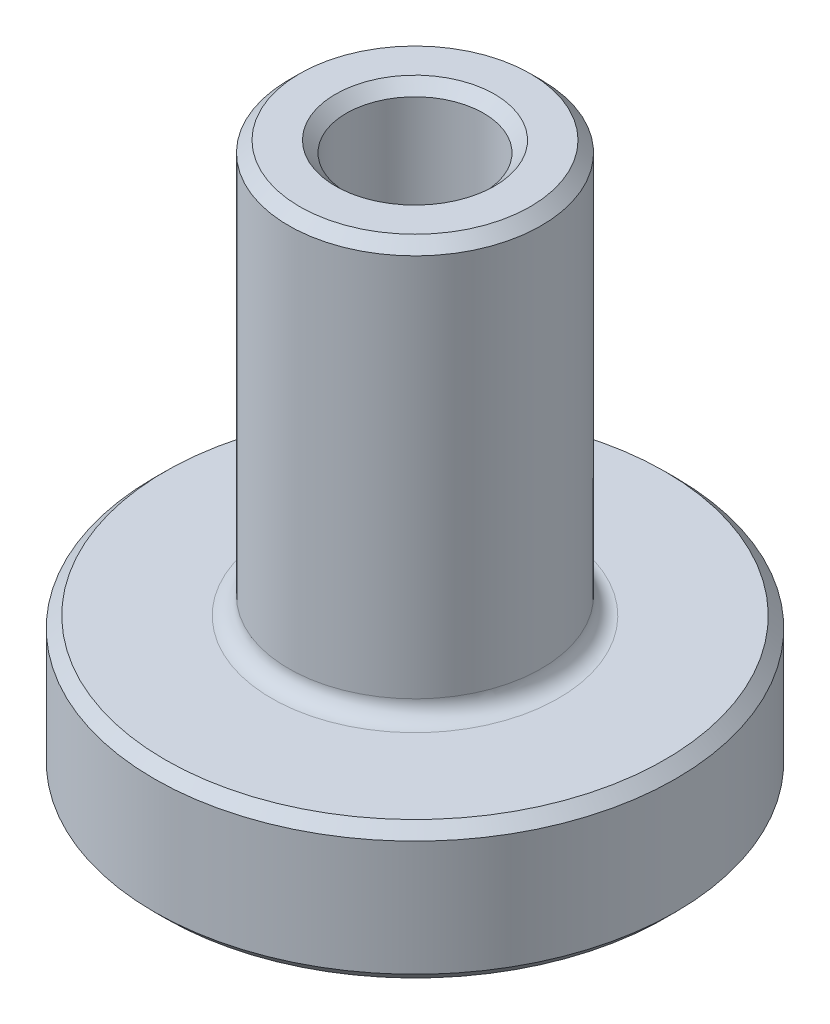
from build123d import *

# Parameters (mm, degrees)
FILLET1_R     = 0.396875
CHAMFER1_SIZE = 0.254


with BuildPart() as part:
    # Sketch1 → Revolve1 (revolve)
    with BuildSketch(Plane.XY):
        Polygon((1.5875, 0), (6.0325, 0), (6.0325, 3.175), (2.921, 3.175), (2.921, 12.7), (1.5875, 12.7), align=None)
    revolve(axis=Axis((0, 7.886499903, 0), (0, -1, 0)))

    # Fillet1
    fillet1_edges = [part.edges().sort_by_distance(p)[0] for p in [
        (-2.921, 3.175, 0),
    ]]
    fillet(fillet1_edges, radius=FILLET1_R)

    # Chamfer1
    chamfer1_edges = [part.edges().sort_by_distance(p)[0] for p in [
        (-6.0325, 0, 0),
        (-6.0325, 3.175, 0),
        (-1.5875, 12.7, 0),
        (-1.5875, 0, 0),
        (-2.921, 12.7, 0),
    ]]
    chamfer(chamfer1_edges, length=CHAMFER1_SIZE)


solid = part.part
